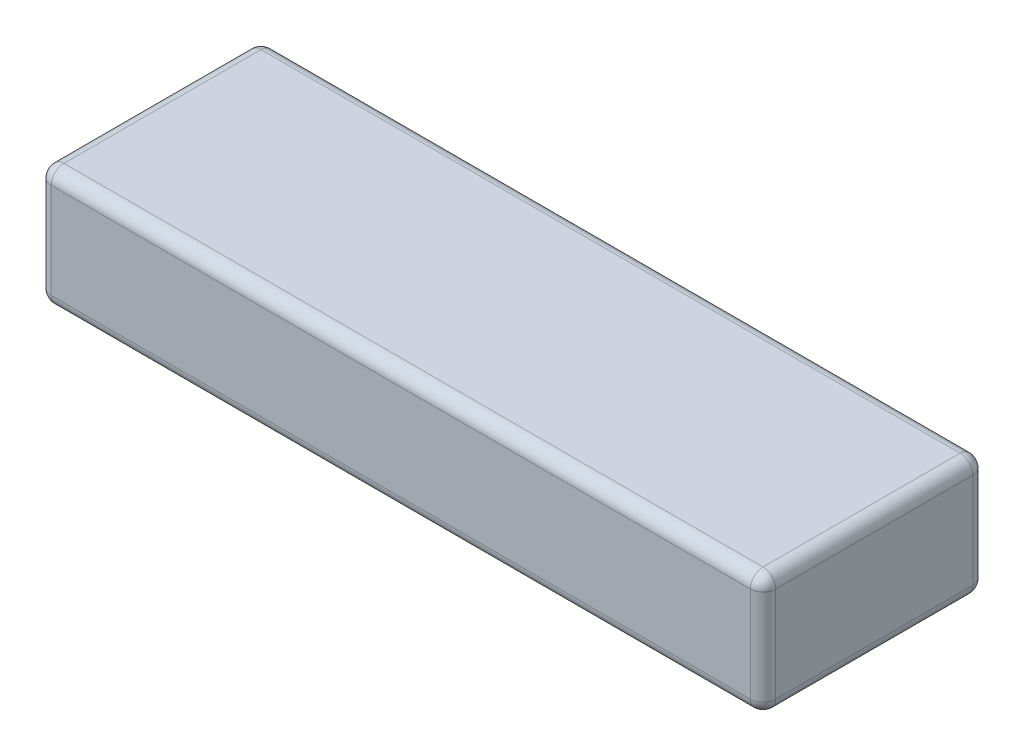
from build123d import *

# Parameters (mm, degrees)
ESBO_O1_W                = 114
ESBO_O1_H                = 35
RESSALTO_EXTRUS_O1_DEPTH = 19
FILETE1_R                = 2
FILETE2_R                = 2


with BuildPart() as part:
    # Esboço1 → Ressalto-extrusão1 (new body)
    with BuildSketch(Plane(origin=(0, 0, 0), x_dir=(1, 0, 0), z_dir=(0, 1, 0))):
        with Locations((57, 17.5)):
            Rectangle(ESBO_O1_W, ESBO_O1_H)
    extrude(amount=RESSALTO_EXTRUS_O1_DEPTH)

    # Filete1
    filete1_edges = [part.edges().sort_by_distance(p)[0] for p in [
        (114, 19, -17.5),
        (57, 19, -35),
        (0, 19, -17.5),
        (57, 0, -35),
        (114, 0, -17.5),
        (57, 0, 0),
        (0, 0, -17.5),
        (57, 19, 0),
    ]]
    fillet(filete1_edges, radius=FILETE1_R)

    # Filete2
    # the kernel refuses this fillet: 2 mm, written as the material it takes off along each edge
    with BuildSketch(Plane(origin=(2, 2, -33), x_dir=(0, 0, -1), z_dir=(-1, 0, 0))) as filete2_piece_1_section:
        Polygon((0, 0), (FILETE2_R, 0), (FILETE2_R, FILETE2_R), (0, FILETE2_R), align=None)
    filete2_piece_1 = extrude(amount=FILETE2_R, mode=Mode.PRIVATE)
    filete2_piece_1 = filete2_piece_1 - Plane(origin=(2, 2, -33), x_dir=(0, 0.7071067811865475, 0.7071067811865475), z_dir=(-1, 0, 0)) * Sphere(FILETE2_R, mode=Mode.PRIVATE)
    add(filete2_piece_1, mode=Mode.SUBTRACT)
    with BuildSketch(Plane(origin=(112, 2, -33), x_dir=(0, 0, -1), z_dir=(1, 0, 0))) as filete2_piece_2_section:
        Polygon((0, 0), (FILETE2_R, 0), (FILETE2_R, -FILETE2_R), (0, -FILETE2_R), align=None)
    filete2_piece_2 = extrude(amount=FILETE2_R, mode=Mode.PRIVATE)
    filete2_piece_2 = filete2_piece_2 - Plane(origin=(112, 2, -33), x_dir=(0, 0.7071067811865475, 0.7071067811865475), z_dir=(1, 0, 0)) * Sphere(FILETE2_R, mode=Mode.PRIVATE)
    add(filete2_piece_2, mode=Mode.SUBTRACT)
    with BuildSketch(Plane(origin=(2, 2, -2), x_dir=(-1, 0, 0), z_dir=(0, 0, 1))) as filete2_piece_3_section:
        Polygon((0, 0), (FILETE2_R, 0), (FILETE2_R, FILETE2_R), (0, FILETE2_R), align=None)
    filete2_piece_3 = extrude(amount=FILETE2_R, mode=Mode.PRIVATE)
    filete2_piece_3 = filete2_piece_3 - Plane(origin=(2, 2, -2), x_dir=(0.7071067811865475, 0.7071067811865475, 0), z_dir=(0, 0, 1)) * Sphere(FILETE2_R, mode=Mode.PRIVATE)
    add(filete2_piece_3, mode=Mode.SUBTRACT)
    with BuildSketch(Plane(origin=(112, 2, -2), x_dir=(1, 0, 0), z_dir=(0, 0, 1))) as filete2_piece_4_section:
        Polygon((0, 0), (FILETE2_R, 0), (FILETE2_R, -FILETE2_R), (0, -FILETE2_R), align=None)
    filete2_piece_4 = extrude(amount=FILETE2_R, mode=Mode.PRIVATE)
    filete2_piece_4 = filete2_piece_4 - Plane(origin=(112, 2, -2), x_dir=(-0.7071067811865475, 0.7071067811865475, 0), z_dir=(0, 0, 1)) * Sphere(FILETE2_R, mode=Mode.PRIVATE)
    add(filete2_piece_4, mode=Mode.SUBTRACT)
    with BuildSketch(Plane(origin=(112, 17, -2), x_dir=(1, 0, 0), z_dir=(0, 0, 1))) as filete2_piece_5_section:
        Polygon((0, 0), (FILETE2_R, 0), (FILETE2_R, FILETE2_R), (0, FILETE2_R), align=None)
    filete2_piece_5 = extrude(amount=FILETE2_R, mode=Mode.PRIVATE)
    filete2_piece_5 = filete2_piece_5 - Plane(origin=(112, 17, -2), x_dir=(-0.7071067811865475, -0.7071067811865475, 0), z_dir=(0, 0, 1)) * Sphere(FILETE2_R, mode=Mode.PRIVATE)
    add(filete2_piece_5, mode=Mode.SUBTRACT)
    with BuildSketch(Plane(origin=(2, 17, -2), x_dir=(-1, 0, 0), z_dir=(0, 0, 1))) as filete2_piece_6_section:
        Polygon((0, 0), (FILETE2_R, 0), (FILETE2_R, -FILETE2_R), (0, -FILETE2_R), align=None)
    filete2_piece_6 = extrude(amount=FILETE2_R, mode=Mode.PRIVATE)
    filete2_piece_6 = filete2_piece_6 - Plane(origin=(2, 17, -2), x_dir=(0.7071067811865475, -0.7071067811865475, 0), z_dir=(0, 0, 1)) * Sphere(FILETE2_R, mode=Mode.PRIVATE)
    add(filete2_piece_6, mode=Mode.SUBTRACT)
    with BuildSketch(Plane(origin=(112, 17, -33), x_dir=(0, 0, -1), z_dir=(1, 0, 0))) as filete2_piece_7_section:
        Polygon((0, 0), (FILETE2_R, 0), (FILETE2_R, FILETE2_R), (0, FILETE2_R), align=None)
    filete2_piece_7 = extrude(amount=FILETE2_R, mode=Mode.PRIVATE)
    filete2_piece_7 = filete2_piece_7 - Plane(origin=(112, 17, -33), x_dir=(0, -0.7071067811865475, 0.7071067811865475), z_dir=(1, 0, 0)) * Sphere(FILETE2_R, mode=Mode.PRIVATE)
    add(filete2_piece_7, mode=Mode.SUBTRACT)
    with BuildSketch(Plane(origin=(2, 17, -33), x_dir=(0, 0, -1), z_dir=(-1, 0, 0))) as filete2_piece_8_section:
        Polygon((0, 0), (FILETE2_R, 0), (FILETE2_R, -FILETE2_R), (0, -FILETE2_R), align=None)
    filete2_piece_8 = extrude(amount=FILETE2_R, mode=Mode.PRIVATE)
    filete2_piece_8 = filete2_piece_8 - Plane(origin=(2, 17, -33), x_dir=(0, -0.7071067811865475, 0.7071067811865475), z_dir=(-1, 0, 0)) * Sphere(FILETE2_R, mode=Mode.PRIVATE)
    add(filete2_piece_8, mode=Mode.SUBTRACT)
    with BuildSketch(Plane(origin=(114, 2, 0), x_dir=(-1, 0, 0), z_dir=(0, 1, 0)), Plane(origin=(114, 2, -35), x_dir=(0, 0, 1), z_dir=(0, 1, 0))) as filete2_piece_9:
        with BuildLine():
            CenterArc((FILETE2_R, -FILETE2_R), FILETE2_R, 90, 90)
            Line((0, -FILETE2_R), (0, 0))
            Line((0, 0), (FILETE2_R, 0))
        make_face()
    extrude(amount=15, mode=Mode.SUBTRACT)
    with BuildSketch(Plane(origin=(0, 2, 0), x_dir=(1, 0, 0), z_dir=(0, 1, 0)), Plane(origin=(0, 2, -35), x_dir=(0, 0, 1), z_dir=(0, 1, 0))) as filete2_piece_10:
        with BuildLine():
            CenterArc((FILETE2_R, FILETE2_R), FILETE2_R, 180, 90)
            Line((0, FILETE2_R), (0, 0))
            Line((0, 0), (FILETE2_R, 0))
        make_face()
    extrude(amount=15, mode=Mode.SUBTRACT)


solid = part.part
